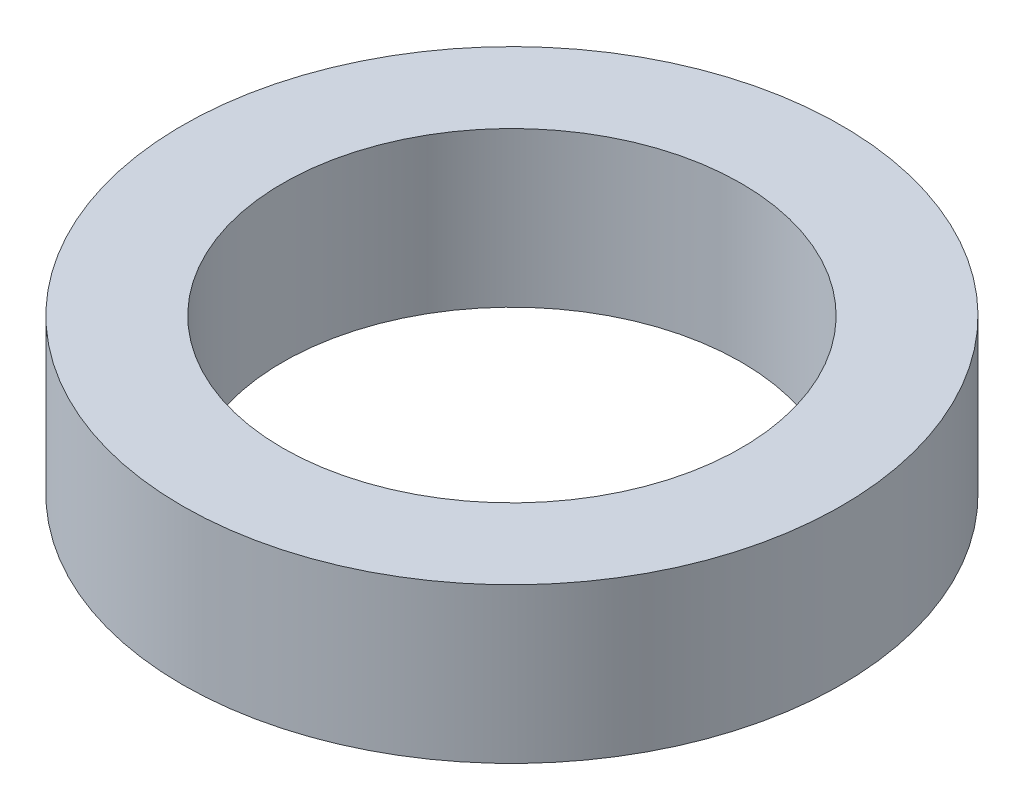
from build123d import *

# Parameters (mm, degrees)
SKETCH1_R           = 57.5
BOSS_EXTRUDE1_DEPTH = 27
SKETCH2_R           = 40
CUT_EXTRUDE1_DEPTH  = 86.68255365


with BuildPart() as part:
    # Sketch1 → Boss-Extrude1 (new body)
    with BuildSketch(Plane(origin=(0, 0, 0), x_dir=(1, 0, 0), z_dir=(0, 1, 0))):
        Circle(SKETCH1_R)
    extrude(amount=BOSS_EXTRUDE1_DEPTH)

    # Sketch2 → Cut-Extrude1 (cut, through all)
    with BuildSketch(Plane(origin=(0, 0, 0), x_dir=(1, 0, 0), z_dir=(0, 1, 0))):
        Circle(SKETCH2_R)
    extrude(amount=CUT_EXTRUDE1_DEPTH, mode=Mode.SUBTRACT)


solid = part.part
